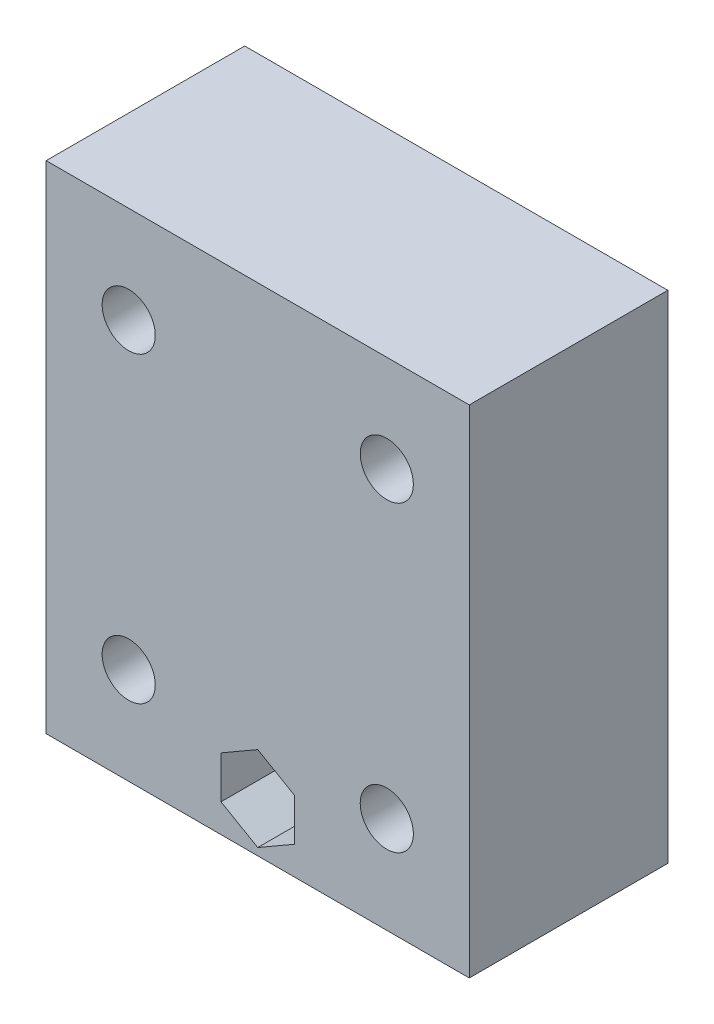
from build123d import *

# Parameters (mm, degrees)
SKETCH1_W           = 42.62295082
SKETCH1_H           = 50
SKETCH1_R           = 2.677018134
BOSS_EXTRUDE1_DEPTH = 20
SKETCH2_R           = 8.73
CUT_EXTRUDE2_DEPTH  = 7.94
SKETCH3_R           = 2.2
CUT_EXTRUDE3_DEPTH  = 10
CUT_EXTRUDE4_START  = -7
CUT_EXTRUDE4_DEPTH  = 32.460095998


with BuildPart() as part:
    # Sketch1 → Boss-Extrude1 (new body)
    with BuildSketch(Plane.XY):
        Rectangle(SKETCH1_W, SKETCH1_H)
        with Locations((-13, -15.25)):
            Circle(SKETCH1_R, mode=Mode.SUBTRACT)
        with Locations((13, -15.25)):
            Circle(SKETCH1_R, mode=Mode.SUBTRACT)
        with Locations((13, 15.25)):
            Circle(SKETCH1_R, mode=Mode.SUBTRACT)
        with Locations((-13, 15.25)):
            Circle(SKETCH1_R, mode=Mode.SUBTRACT)
    extrude(amount=BOSS_EXTRUDE1_DEPTH)

    # Sketch2 → Cut-Extrude2 (cut)
    with BuildSketch(Plane.XY):
        Circle(SKETCH2_R)
    extrude(amount=CUT_EXTRUDE2_DEPTH, mode=Mode.SUBTRACT)

    # Sketch3 → Cut-Extrude3 (cut)
    with BuildSketch(Plane(origin=(0, 0, 0), x_dir=(-1, 0, 0), z_dir=(0, 0, -1))):
        with Locations((0, -20)):
            Circle(SKETCH3_R)
    extrude(amount=-CUT_EXTRUDE3_DEPTH, mode=Mode.SUBTRACT)

    # Sketch5 → Cut-Extrude4 (cut, through all)
    with BuildSketch(Plane(origin=(0, 0, 0), x_dir=(-1, 0, 0), z_dir=(0, 0, -1)).offset(CUT_EXTRUDE4_START)):
        Polygon((0, -15.727608008), (-3.7, -17.863804004), (-3.7, -22.136195996), (0, -24.272391992), (3.7, -22.136195996), (3.7, -17.863804004), align=None)
    extrude(amount=-CUT_EXTRUDE4_DEPTH, mode=Mode.SUBTRACT)


solid = part.part
